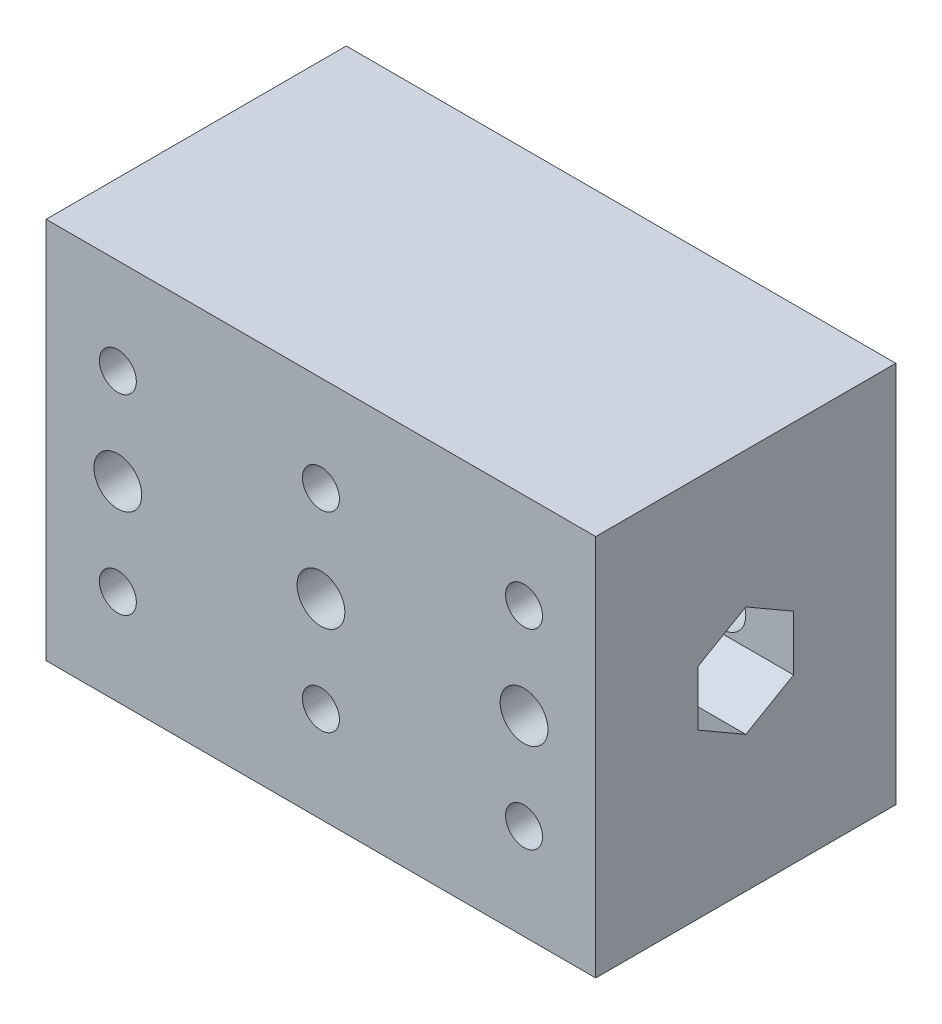
from build123d import *

# Parameters (mm, degrees)
SKETCH1_W                    = 39.878
SKETCH1_H                    = 50.8
BOSS_EXTRUDE1_DEPTH          = 73.025
CUT_EXTRUDE2_DEPTH           = 80.845941325
SKETCH9_R                    = 3.175
CUT_EXTRUDE4_DEPTH           = 87.994629196
CUT_SWEEP1_START             = 11.39698
CUT_SWEEP1_DEPTH             = 6.35
CUT_SWEEP1_START_2           = 55.27802
CUT_SWEEP1_2_DEPTH           = 6.35
F_10_0_1935_DIAMETER_HOLE1_D = 4.9149


# Read off the part's stored shape, not the designer's step: Cut-Sweep1
with BuildPart() as part:
    # Sketch1 → Boss-Extrude1 (new body)
    with BuildSketch(Plane(origin=(0, 0, 0), x_dir=(0, 0, -1), z_dir=(1, 0, 0))):
        Rectangle(SKETCH1_W, SKETCH1_H)
    extrude(amount=BOSS_EXTRUDE1_DEPTH)

    # Sketch3 → Cut-Extrude2 (cut, through all)
    with BuildSketch(Plane(origin=(73.025, 0, 0), x_dir=(0, 0, -1), z_dir=(1, 0, 0))):
        Polygon((6.35, 3.666174209), (0, 7.332348419), (-6.35, 3.666174209), (-6.35, -3.666174209), (0, -7.332348419), (6.35, -3.666174209), align=None)
    extrude(amount=-CUT_EXTRUDE2_DEPTH, mode=Mode.SUBTRACT)

    # Sketch9 → Cut-Extrude4 (cut, through all)
    with BuildSketch(Plane.XY.offset(19.939)):
        with Locations((9.525, 0)):
            Circle(SKETCH9_R)
        with Locations((36.5125, 0)):
            Circle(SKETCH9_R)
        with Locations((63.5, 0)):
            Circle(SKETCH9_R)
    extrude(amount=-CUT_EXTRUDE4_DEPTH, mode=Mode.SUBTRACT)

    # Cut-Sweep1 outline → Cut-Sweep1 (cut)
    with BuildSketch(Plane.YZ.offset(CUT_SWEEP1_START)):
        with BuildLine():
            add(Edge.make_bspline(
                [(-25.4, -15.1765), (-24.598155248, -15.176498148), (-23.769283214, -15.020738143), (-22.215051315, -14.383830521), (-21.491956074, -13.903011028), (-20.295262296, -12.697601351), (-19.822999045, -11.974685313), (-19.200412611, -10.432467289), (-19.050000001, -9.615195458), (-19.050000001, -8.8265)],
                knots=[0.025274121, 0.025274121, 0.025274121, 0.025274121, 0.088238261, 0.088238261, 0.1512024, 0.1512024, 0.214166539, 0.214166539, 0.277130679, 0.277130679, 0.277130679, 0.277130679], degree=3))
            Line((-25.4, -15.1765), (-25.4, -18.3515))
            add(Edge.make_bspline(
                [(-25.4, -18.3515), (-24.198801546, -18.351496292), (-22.962872636, -18.121523992), (-20.613629157, -17.158829003), (-19.544786623, -16.448168929), (-17.736040932, -14.626249639), (-17.037863537, -13.557113154), (-16.097253947, -11.227115749), (-15.875000001, -10.018094012), (-15.875000001, -8.8265)],
                knots=[0.025274121, 0.025274121, 0.025274121, 0.025274121, 0.088238261, 0.088238261, 0.1512024, 0.1512024, 0.214166539, 0.214166539, 0.277130679, 0.277130679, 0.277130679, 0.277130679], degree=3))
            Line((-15.875000001, -8.8265), (-15.875000001, 8.8265))
            add(Edge.make_bspline(
                [(-15.875000001, 8.8265), (-15.875000001, 10.154104999), (-16.148999917, 11.520161211), (-17.372865777, 14.155841649), (-18.276999964, 15.317491554), (-20.555768544, 17.157379798), (-21.841496853, 17.764411009), (-23.809992027, 18.242095131), (-24.446817823, 18.324942193), (-25.191458658, 18.349851774), (-25.29770495, 18.351585251), (-25.4, 18.351845725)],
                knots=[0.722867996, 0.722867996, 0.722867996, 0.722867996, 0.792150997, 0.792150997, 0.861433998, 0.861433998, 0.930716999, 0.930716999, 0.9653585, 0.9653585, 0.971358568, 0.971358568, 0.971358568, 0.971358568], degree=3))
            Line((-25.4, 18.351845725), (-25.4, 15.17649118))
            add(Edge.make_bspline(
                [(-19.050000001, 8.8265), (-19.050000001, 9.700178846), (-19.23785851, 10.633454764), (-20.043385287, 12.368213809), (-20.66121287, 13.161804707), (-22.160632803, 14.372442861), (-23.034678664, 14.786809878), (-24.336487637, 15.102712151), (-24.768983217, 15.158942974), (-25.259087559, 15.175338178), (-25.32981717, 15.176428808), (-25.4, 15.17649118)],
                knots=[0.722867996, 0.722867996, 0.722867996, 0.722867996, 0.792150997, 0.792150997, 0.861433998, 0.861433998, 0.930716999, 0.930716999, 0.9653585, 0.9653585, 0.971266218, 0.971266218, 0.971266218, 0.971266218], degree=3))
            Line((-19.050000001, 8.8265), (-19.050000001, -8.8265))
        make_face()
    extrude(amount=CUT_SWEEP1_DEPTH, mode=Mode.SUBTRACT)

    # Cut-Sweep1 2 outline → Cut-Sweep1 2 (cut)
    with BuildSketch(Plane.YZ.offset(CUT_SWEEP1_START_2)):
        with BuildLine():
            add(Edge.make_bspline(
                [(-25.4, -15.1765), (-24.598155248, -15.176498148), (-23.769283214, -15.020738143), (-22.215051315, -14.383830521), (-21.491956074, -13.903011028), (-20.295262296, -12.697601351), (-19.822999045, -11.974685313), (-19.200412611, -10.432467289), (-19.050000001, -9.615195458), (-19.050000001, -8.8265)],
                knots=[0.025274121, 0.025274121, 0.025274121, 0.025274121, 0.088238261, 0.088238261, 0.1512024, 0.1512024, 0.214166539, 0.214166539, 0.277130679, 0.277130679, 0.277130679, 0.277130679], degree=3))
            Line((-25.4, -15.1765), (-25.4, -18.3515))
            add(Edge.make_bspline(
                [(-25.4, -18.3515), (-24.198801546, -18.351496292), (-22.962872636, -18.121523992), (-20.613629157, -17.158829003), (-19.544786623, -16.448168929), (-17.736040932, -14.626249639), (-17.037863537, -13.557113154), (-16.097253947, -11.227115749), (-15.875000001, -10.018094012), (-15.875000001, -8.8265)],
                knots=[0.025274121, 0.025274121, 0.025274121, 0.025274121, 0.088238261, 0.088238261, 0.1512024, 0.1512024, 0.214166539, 0.214166539, 0.277130679, 0.277130679, 0.277130679, 0.277130679], degree=3))
            Line((-15.875000001, -8.8265), (-15.875000001, 8.8265))
            add(Edge.make_bspline(
                [(-15.875000001, 8.8265), (-15.875000001, 10.154104999), (-16.148999917, 11.520161211), (-17.372865777, 14.155841649), (-18.276999964, 15.317491554), (-20.555768544, 17.157379798), (-21.841496853, 17.764411009), (-23.809992027, 18.242095131), (-24.446817823, 18.324942193), (-25.191458658, 18.349851774), (-25.29770495, 18.351585251), (-25.4, 18.351845725)],
                knots=[0.722867996, 0.722867996, 0.722867996, 0.722867996, 0.792150997, 0.792150997, 0.861433998, 0.861433998, 0.930716999, 0.930716999, 0.9653585, 0.9653585, 0.971358568, 0.971358568, 0.971358568, 0.971358568], degree=3))
            Line((-25.4, 18.351845725), (-25.4, 15.17649118))
            add(Edge.make_bspline(
                [(-19.050000001, 8.8265), (-19.050000001, 9.700178846), (-19.23785851, 10.633454764), (-20.043385287, 12.368213809), (-20.66121287, 13.161804707), (-22.160632803, 14.372442861), (-23.034678664, 14.786809878), (-24.336487637, 15.102712151), (-24.768983217, 15.158942974), (-25.259087559, 15.175338178), (-25.32981717, 15.176428808), (-25.4, 15.17649118)],
                knots=[0.722867996, 0.722867996, 0.722867996, 0.722867996, 0.792150997, 0.792150997, 0.861433998, 0.861433998, 0.930716999, 0.930716999, 0.9653585, 0.9653585, 0.971266218, 0.971266218, 0.971266218, 0.971266218], degree=3))
            Line((-19.050000001, 8.8265), (-19.050000001, -8.8265))
        make_face()
    extrude(amount=CUT_SWEEP1_2_DEPTH, mode=Mode.SUBTRACT)

    # #10 (0.1935) Diameter Hole1 (through all)
    with Locations(Plane.XY.offset(19.939)):
        with Locations((9.525, 12.7), (36.5125, 12.7), (63.5, 12.7), (63.5, -12.7), (36.5125, -12.7), (9.525, -12.7)):
            Hole(F_10_0_1935_DIAMETER_HOLE1_D / 2)


solid = part.part
